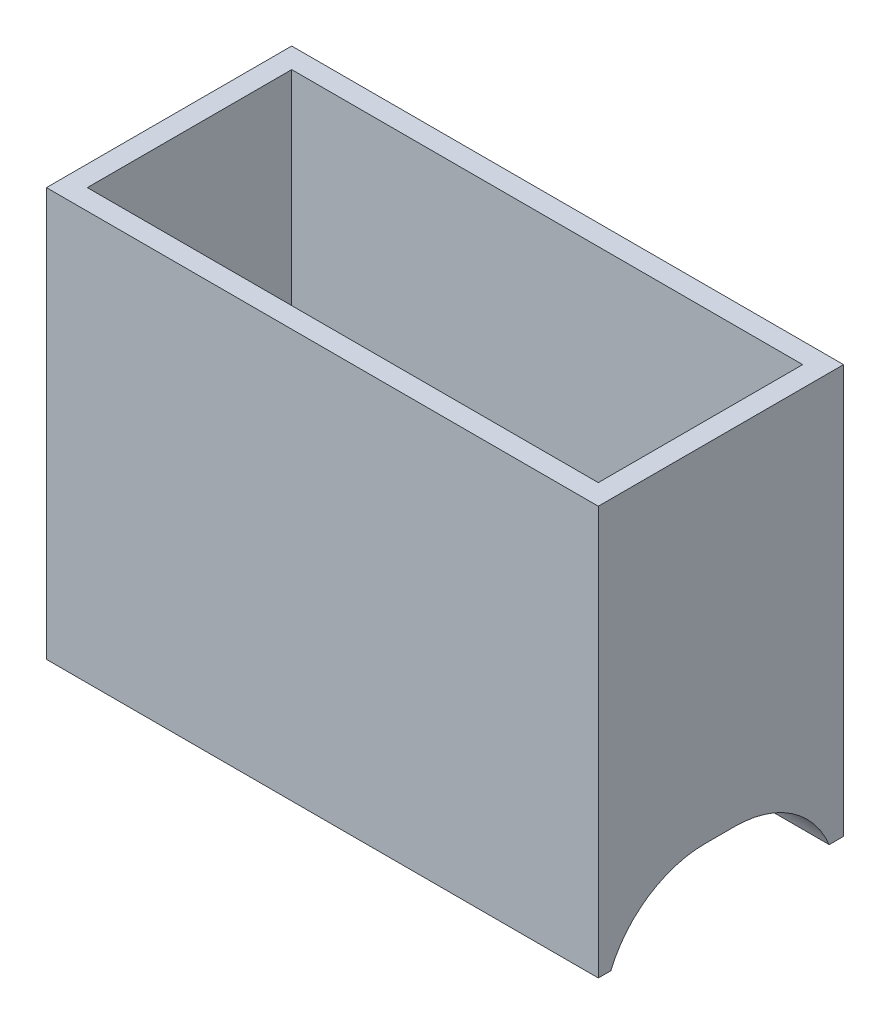
from build123d import *

# Parameters (mm, degrees)
SURFACE_EXTRUSION1_1_DEPTH = 30
EPAISSIR1_T1               = 2
EPAISSIR2_OUTLINE_W        = 50
EPAISSIR2_OUTLINE_H        = 20
EPAISSIR2_DEPTH            = 2
BOSS_EXTRU_1_DEPTH         = 54
CONG_1_R                   = 10


# Read off the part's stored shape, not the designer's step: Epaissir2
with BuildPart() as body_1:
    # Surface-Extrusion1: a surface, the sketch's curves swept straight by 30 mm
    with BuildLine(Plane(origin=(0, 0, 0), x_dir=(1, 0, 0), z_dir=(0, 1, 0)), mode=Mode.PRIVATE) as surface_extrusion1_1_path:
        Line((0, 0), (-50, 0))
        Line((-50, 0), (-50, 20))
        Line((-50, 20), (0, 20))
        Line((0, 20), (0, 0))
    surface_extrusion1_1 = Shell.extrude(surface_extrusion1_1_path.wire(), (0 * SURFACE_EXTRUSION1_1_DEPTH, 1 * SURFACE_EXTRUSION1_1_DEPTH, 0 * SURFACE_EXTRUSION1_1_DEPTH))
    add(Solid.thicken(surface_extrusion1_1, EPAISSIR1_T1))

    # Epaissir2 outline → Epaissir2 (add)
    with BuildSketch(Plane(origin=(0, 0, 0), x_dir=(1, 0, 0), z_dir=(0, 1, 0))):
        with Locations((-25, 10)):
            Rectangle(EPAISSIR2_OUTLINE_W, EPAISSIR2_OUTLINE_H)
    extrude(amount=EPAISSIR2_DEPTH)

    # Esquisse3 → Boss.-Extru.1 (add)
    with BuildSketch(Plane.ZY.offset(52)):
        Polygon((-22, 0), (-22, -9.980445305), (-20.597715591, -9.980445305), (-20.597715591, -3.819178115), (0.770065176, -3.819178115), (0.770065176, -9.980445305), (2, -9.980445305), (2, 0), align=None)
    extrude(amount=-BOSS_EXTRU_1_DEPTH)

    # Congé1
    # the kernel refuses this fillet: 10 mm, written as the material it adds along each edge
    with BuildSketch(Plane(origin=(-52, -3.819178115, 0.770065176), x_dir=(0, -1, 0), z_dir=(1, 0, 0))) as cong_1_piece_1:
        with BuildLine():
            CenterArc((10, 9.233857829), CONG_1_R, 180, 67.426190035)
            Line((0, 9.233857829), (-0.2, 9.233857829))
            Line((-0.2, 9.233857829), (-0.2, 0))
            Line((-0.2, 0), (0, -0.2))
            ThreePointArc((0, -0.2), (3.080633595, -0.2), (6.084492534, -0.184677157))
            Line((6.084492534, -0.184677157), (6.16126719, 0))
        make_face()
    extrude(amount=54)
    with BuildSketch(Plane(origin=(-52, -3.819178115, -20.597715591), x_dir=(0, 0, 1), z_dir=(1, 0, 0))) as cong_1_piece_2:
        with BuildLine():
            CenterArc((9.233857829, 10), CONG_1_R, 202.573809965, 67.426190035)
            Line((0, 6.16126719), (-0.184677157, 6.084492534))
            ThreePointArc((-0.184677157, 6.084492534), (-0.2, 3.080633595), (-0.2, 0))
            Line((-0.2, 0), (0, -0.2))
            Line((0, -0.2), (9.233857829, -0.2))
            Line((9.233857829, -0.2), (9.233857829, 0))
        make_face()
    extrude(amount=54)


solid = body_1.part
